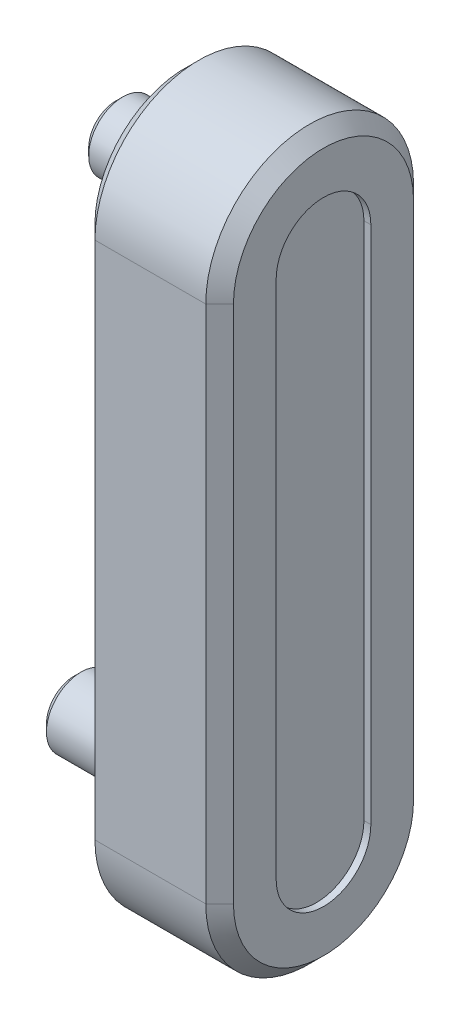
from build123d import *

# Parameters (mm, degrees)
SKETCH_1_R          = 4.9
EXTRUDE_1_DEPTH     = 10
EXTRUDE_2_DEPTH     = 20
SKETCH_3_R          = 5
EXTRUDE_3_DEPTH     = 16
CHAMFER_1_SIZE      = 2
CUT_EXTRUDE_1_DEPTH = 1
SKETCH_5_R          = 10
EXTRUDE_4_DEPTH     = 1
CHAMFER_2_SIZE      = 1
CHAMFER_3_SIZE      = 1


with BuildPart() as part:
    # 草图1 → 凸台-拉伸1 (new body)
    with BuildSketch(Plane(origin=(0, 0, 0), x_dir=(0, 0, -1), z_dir=(1, 0, 0))):
        Circle(SKETCH_1_R)
    extrude(amount=EXTRUDE_1_DEPTH)

    # 草图2 → 凸台-拉伸2 (add)
    with BuildSketch(Plane(origin=(10, 0, 0), x_dir=(0, 0, -1), z_dir=(1, 0, 0))):
        with BuildLine():
            Line((15, 0), (15, -75))
            ThreePointArc((15, -75), (0, -90), (-15, -75))
            Line((-15, -75), (-15, 0))
            ThreePointArc((-15, 0), (0, 15), (15, 0))
        make_face()
    extrude(amount=EXTRUDE_2_DEPTH)

    # 草图3 → 凸台-拉伸3 (add)
    with BuildSketch(Plane.ZY.offset(-10)):
        with Locations(Location((0, -75, 0), (0, 0, 180))):
            Circle(SKETCH_3_R)
    extrude(amount=EXTRUDE_3_DEPTH)

    # 倒角1
    chamfer_1_edges = [part.edges().sort_by_distance(p)[0] for p in [
        (10, -37.5, 15),
        (10, -90, 0),
        (30, -37.5, -15),
        (10, 15, 0),
        (30, -37.5, 15),
        (30, -90, 0),
        (30, 15, 0),
        (10, -37.5, -15),
    ]]
    chamfer(chamfer_1_edges, length=CHAMFER_1_SIZE)

    # 草图4 → 切除-拉伸1 (cut)
    with BuildSketch(Plane(origin=(30, 0, 0), x_dir=(0, 0, -1), z_dir=(1, 0, 0))):
        with BuildLine():
            Line((6.835634275, 0), (6.835634275, -75))
            ThreePointArc((6.835634275, -75), (0, -81.835634275), (-6.835634275, -75))
            Line((-6.835634275, -75), (-6.835634275, 0))
            ThreePointArc((-6.835634275, 0), (0, 6.835634275), (6.835634275, 0))
        make_face()
    extrude(amount=-CUT_EXTRUDE_1_DEPTH, mode=Mode.SUBTRACT)

    # 草图5 → 凸台-拉伸4 (add)
    with BuildSketch(Plane.ZY.offset(-10)):
        with Locations(Location((0, -75, 0), (0, 0, 180))):
            Circle(SKETCH_5_R)
    extrude(amount=EXTRUDE_4_DEPTH)

    # 倒角2
    chamfer_2_edges = [part.edges().sort_by_distance(p)[0] for p in [
        (9, -75, 10),
    ]]
    chamfer(chamfer_2_edges, length=CHAMFER_2_SIZE - 0.0001)  # a hair under: the kernel refuses the full size

    # 倒角3
    chamfer_3_edges = [part.edges().sort_by_distance(p)[0] for p in [
        (-6, -75, 5),
        (0, 0, 4.9),
    ]]
    chamfer(chamfer_3_edges, length=CHAMFER_3_SIZE)


solid = part.part
